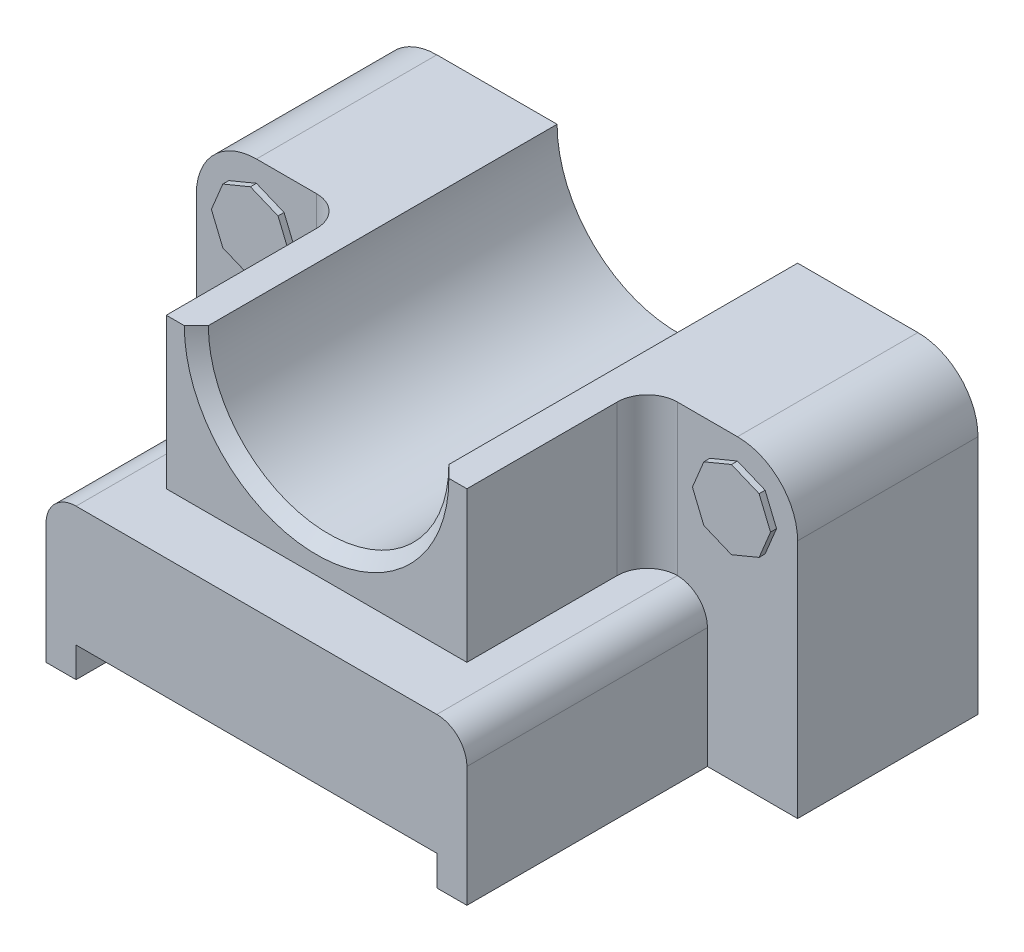
from build123d import *

# Parameters (mm, degrees)
CROQUIS1_W              = 100
CROQUIS1_H              = 50
SALIENTE_EXTRUIR1_DEPTH = 30
CROQUIS2_W              = 70
CROQUIS2_H              = 25
SALIENTE_EXTRUIR2_DEPTH = 40
CROQUIS3_W              = 50
CROQUIS3_H              = 25
SALIENTE_EXTRUIR3_DEPTH = 30
CROQUIS4_R              = 20
CORTAR_EXTRUIR1_DEPTH   = 83.006097334
CHAFL_N1_SIZE           = 2
CROQUIS5_W              = 60
CROQUIS5_H              = 5
CORTAR_EXTRUIR2_DEPTH   = 90.582364336
REDONDEO1_R             = 10
REDONDEO2_R             = 5
CROQUIS6_R              = 5
CORTAR_EXTRUIR3_DEPTH   = 69.738635424
SALIENTE_EXTRUIR4_DEPTH = 1


with BuildPart() as part:
    # Croquis1 → Saliente-Extruir1 (new body)
    with BuildSketch(Plane.XY):
        Rectangle(CROQUIS1_W, CROQUIS1_H)
    extrude(amount=SALIENTE_EXTRUIR1_DEPTH)

    # Croquis2 → Saliente-Extruir2 (add)
    with BuildSketch(Plane.XY.offset(30)):
        with Locations((0, -12.5)):
            Rectangle(CROQUIS2_W, CROQUIS2_H)
    extrude(amount=SALIENTE_EXTRUIR2_DEPTH)

    # Croquis3 → Saliente-Extruir3 (add)
    with BuildSketch(Plane.XY.offset(30)):
        with Locations((0, 12.5)):
            Rectangle(CROQUIS3_W, CROQUIS3_H)
    extrude(amount=SALIENTE_EXTRUIR3_DEPTH)

    # Croquis4 → Cortar-Extruir1 (cut, through all)
    with BuildSketch(Plane.XY.offset(60)):
        with Locations((0, 25)):
            Circle(CROQUIS4_R)
    extrude(amount=-CORTAR_EXTRUIR1_DEPTH, mode=Mode.SUBTRACT)

    # Chaflán1
    chafl_n1_edges = [part.edges().sort_by_distance(p)[0] for p in [
        (0, 5, 60),
    ]]
    chamfer(chafl_n1_edges, length=CHAFL_N1_SIZE)

    # Croquis5 → Cortar-Extruir2 (cut, through all)
    with BuildSketch(Plane.XY.offset(70)):
        with Locations((0, -22.5)):
            Rectangle(CROQUIS5_W, CROQUIS5_H)
    extrude(amount=-CORTAR_EXTRUIR2_DEPTH, mode=Mode.SUBTRACT)

    # Redondeo1
    redondeo1_edges = [part.edges().sort_by_distance(p)[0] for p in [
        (-50, 25, 15),
        (50, 25, 15),
    ]]
    fillet(redondeo1_edges, radius=REDONDEO1_R)

    # Redondeo2
    redondeo2_edges = [part.edges().sort_by_distance(p)[0] for p in [
        (-35, 0, 50),
        (35, 0, 50),
        (-25, 12.5, 30),
        (25, 12.5, 30),
    ]]
    fillet(redondeo2_edges, radius=REDONDEO2_R - 0.0001)  # a hair under: the kernel refuses the full size

    # Croquis6 → Cortar-Extruir3 (cut, through all)
    with BuildSketch(Plane.XY.offset(30)):
        with Locations((-40, 15)):
            Circle(CROQUIS6_R)
        with Locations((40, 15)):
            Circle(CROQUIS6_R)
    extrude(amount=-CORTAR_EXTRUIR3_DEPTH, mode=Mode.SUBTRACT)

    # Croquis9 → Saliente-Extruir4 (add)
    with BuildSketch(Plane.XY.offset(30)):
        Polygon((-40, 21.494353202), (-44.592201188, 19.592201188), (-46.494353202, 15), (-44.592201188, 10.407798812), (-40, 8.505646798), (-35.407798812, 10.407798812), (-33.505646798, 15), (-35.407798812, 19.592201188), align=None)
        Polygon((40, 21.494353202), (35.407798812, 19.592201188), (33.505646798, 15), (35.407798812, 10.407798812), (40, 8.505646798), (44.592201188, 10.407798812), (46.494353202, 15), (44.592201188, 19.592201188), align=None)
    extrude(amount=SALIENTE_EXTRUIR4_DEPTH)


solid = part.part
